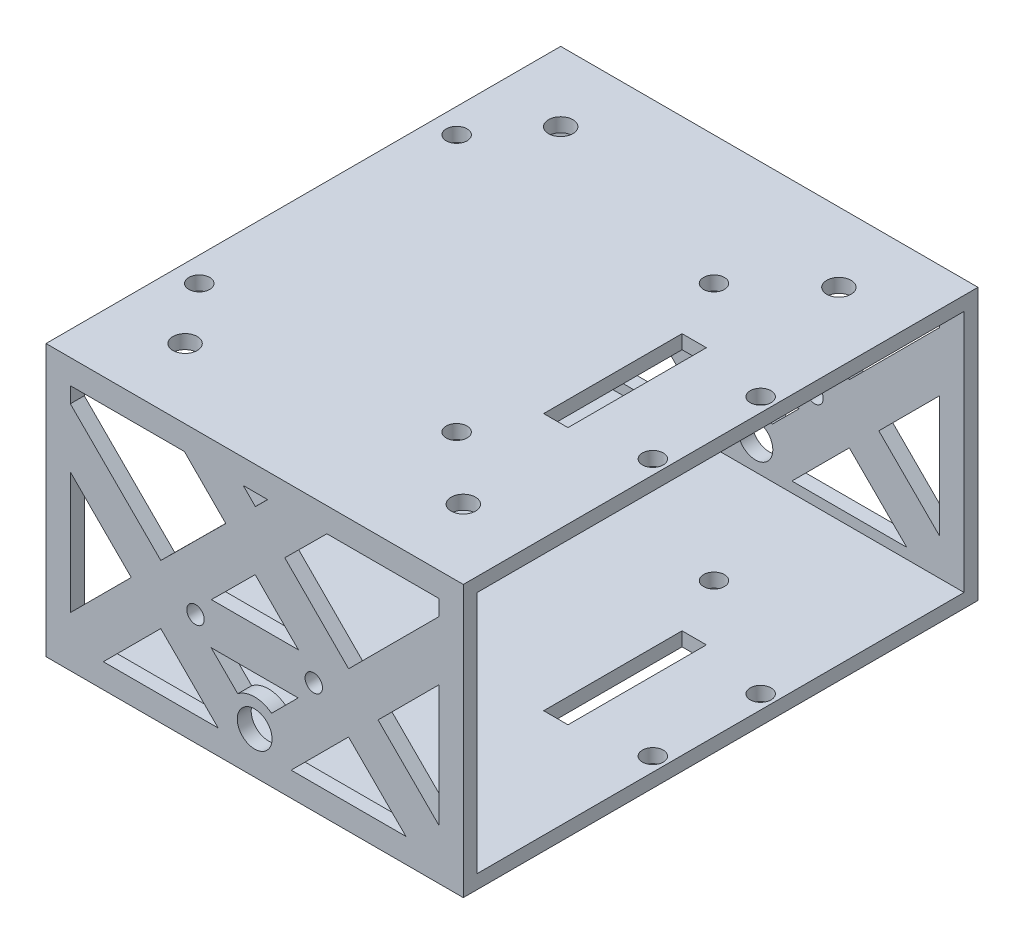
from build123d import *

# Parameters (mm, degrees)
BOSS_EXTRUDE1_DEPTH      = 30
BOSS_EXTRUDE1_DEPTH_BACK = 30
SKETCH2_W                = 74
SKETCH2_H                = 39
SKETCH2_W_2              = 70
SKETCH2_H_2              = 35
CUT_EXTRUDE1_DEPTH       = 65.171644829
CUT_EXTRUDE1_DEPTH_BACK  = 65.171644829
SKETCH1_R                = 1.25
SKETCH1_R_2              = 2.5
CUT_EXTRUDE2_START       = -37
CUT_EXTRUDE2_DEPTH       = 74
SKETCH4_R                = 1.75
CUT_EXTRUDE3_DEPTH       = 3
CUT_EXTRUDE4_DEPTH       = 61.3158354
CUT_EXTRUDE4_DEPTH_BACK  = 61.3158354
SKETCH5_R                = 1.5
SKETCH5_W                = 3.5
SKETCH5_H                = 19.9


# Read off the part's stored shape, not the designer's step: Cut-Extrude2
with BuildPart() as part:
    # Sketch2 → Boss-Extrude1 (new, two sides: drawn at the far end of the back side and taken through both)
    with BuildSketch(Plane(origin=(0, 0, 0), x_dir=(0, 0, -1), z_dir=(1, 0, 0)).offset(-BOSS_EXTRUDE1_DEPTH_BACK)):
        with Locations((0, 23.5)):
            Rectangle(SKETCH2_W, SKETCH2_H)
        with Locations((0, 23.5)):
            Rectangle(SKETCH2_W_2, SKETCH2_H_2, mode=Mode.SUBTRACT)
    extrude(amount=BOSS_EXTRUDE1_DEPTH + BOSS_EXTRUDE1_DEPTH_BACK)

    # Sketch1 → Cut-Extrude1 (cut, two sides: drawn at the far end of the back side and taken through both)
    with BuildSketch(Plane.XY.offset(-CUT_EXTRUDE1_DEPTH_BACK)):
        with Locations((8.5, 20)):
            Circle(SKETCH1_R)
        with Locations((-8.5, 20)):
            Circle(SKETCH1_R)
        with Locations((0, 10)):
            Circle(SKETCH1_R_2)
    extrude(amount=CUT_EXTRUDE1_DEPTH + CUT_EXTRUDE1_DEPTH_BACK, mode=Mode.SUBTRACT)

    # Cut-Extrude2 outline → Cut-Extrude2 (cut)
    with BuildSketch(Plane.XY.offset(CUT_EXTRUDE2_START)):
        Polygon((-6.223385238, 23), (6.291063493, 23), (0.075182746, 29.257087778), align=None)
        Polygon((-13.493003356, 24.235644043), (-4.153418424, 33.513721677), (-10.100273174, 39.5), (-26.5, 39.5), (-26.5, 37.242640687), align=None)
        Polygon((10.385998459, 39.5), (4.331816644, 33.485688948), (13.507019797, 24.249660484), (26.5, 37.242640687), (26.5, 39.5), align=None)
        Polygon((21.757359313, 7.5), (13.5, 15.757359313), (5.242640687, 7.5), align=None)
        Polygon((26.5, 28.757359313), (17.742640687, 20), (26.5, 11.242640687), align=None)
        Polygon((-13.5, 15.757359313), (-21.757359313, 7.5), (-5.242640687, 7.5), align=None)
        with BuildLine():
            Line((2.432627089, 13.175267776), (6.257359313, 17))
            Line((6.257359313, 17), (-6.257359313, 17))
            Line((-6.257359313, 17), (-2.432627089, 13.175267776))
            ThreePointArc((-2.432627089, 13.175267776), (0, 14), (2.432627089, 13.175267776))
        make_face()
        Polygon((-26.5, 11.242640687), (-17.742640687, 20), (-26.5, 28.757359313), align=None)
        Polygon((1.872544824, 39.5), (-1.642886221, 39.5), (0.103215475, 37.742322846), align=None)
    extrude(amount=CUT_EXTRUDE2_DEPTH, mode=Mode.SUBTRACT)

    # Sketch4 → Cut-Extrude3 (cut)
    with BuildSketch(Plane(origin=(0, 43, 0), x_dir=(1, 0, 0), z_dir=(0, 1, 0))):
        with Locations(Location((-20, 27, 0), (0, 0, 270))):
            Circle(SKETCH4_R)
        with Locations(Location((20, 27, 0), (0, 0, 270))):
            Circle(SKETCH4_R)
        with Locations(Location((20, -27, 0), (0, 0, 270))):
            Circle(SKETCH4_R)
        with Locations(Location((-20, -27, 0), (0, 0, 270))):
            Circle(SKETCH4_R)
    extrude(amount=-CUT_EXTRUDE3_DEPTH, mode=Mode.SUBTRACT)

    # Sketch5 → Cut-Extrude4 (cut, two sides: drawn at the far end of the back side and taken through both)
    with BuildSketch(Plane(origin=(0, 6, 0), x_dir=(1, 0, 0), z_dir=(0, 1, 0)).offset(-CUT_EXTRUDE4_DEPTH_BACK)):
        with Locations(Location((-26.460092097, -18.5, 0), (0, 0, 270))):
            Circle(SKETCH5_R)
        with Locations(Location((-26.460092097, 18.5, 0), (0, 0, 270))):
            Circle(SKETCH5_R)
        with Locations(Location((10.539907903, 18.5, 0), (0, 0, 270))):
            Circle(SKETCH5_R)
        with Locations(Location((10.539907903, -18.5, 0), (0, 0, 270))):
            Circle(SKETCH5_R)
        with Locations(Location((28, -7.75, 0), (0, 0, 270))):
            Circle(SKETCH5_R)
        with Locations(Location((28, 7.75, 0), (0, 0, 270))):
            Circle(SKETCH5_R)
        with Locations((16.25, 0)):
            Rectangle(SKETCH5_W, SKETCH5_H)
    extrude(amount=CUT_EXTRUDE4_DEPTH + CUT_EXTRUDE4_DEPTH_BACK, mode=Mode.SUBTRACT)


solid = part.part
